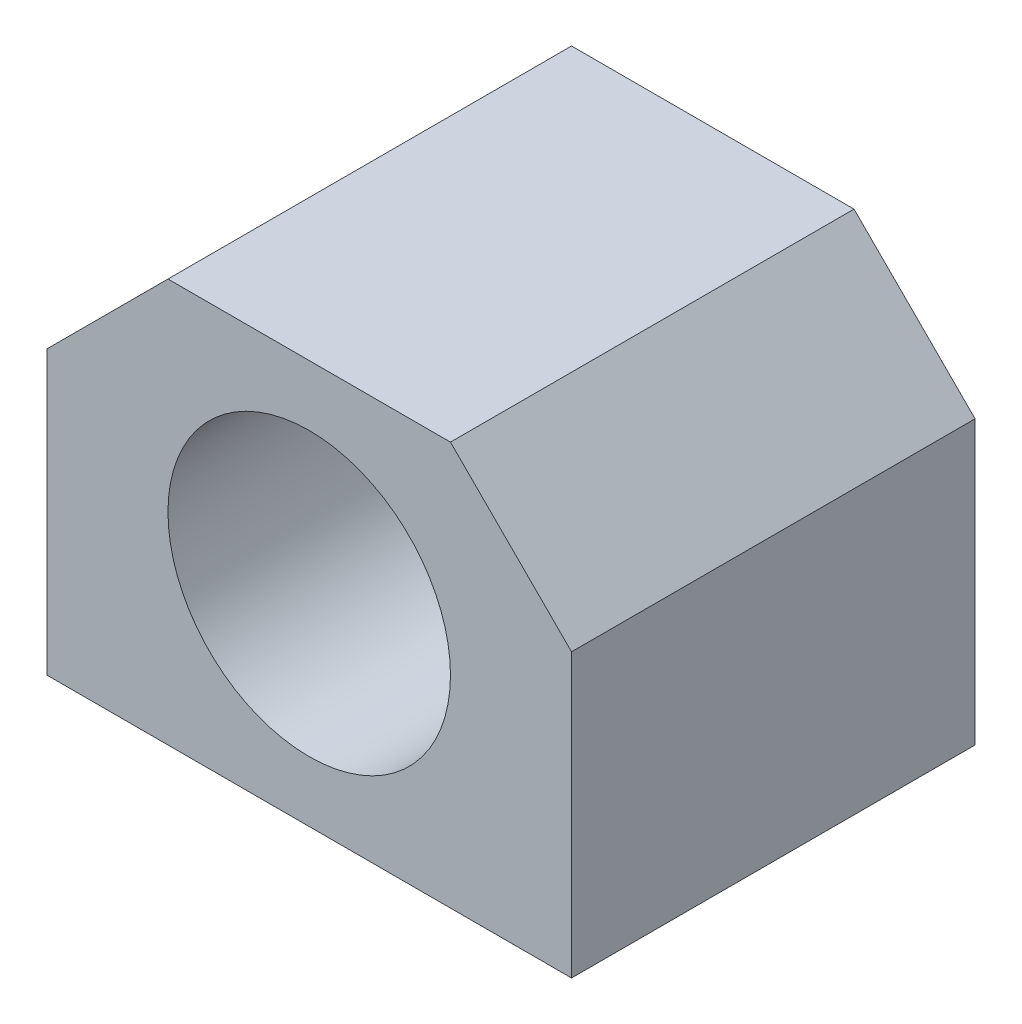
from build123d import *

# Parameters (mm, degrees)
SKETCH1_R           = 14
BOSS_EXTRUDE1_DEPTH = 40


with BuildPart() as part:
    # Sketch1 → Boss-Extrude1 (new body)
    with BuildSketch(Plane.XY):
        Polygon((-14, 20), (14, 20), (26, 8), (26, -20), (-26, -20), (-26, 8), align=None)
        Circle(SKETCH1_R, mode=Mode.SUBTRACT)
    extrude(amount=BOSS_EXTRUDE1_DEPTH)


solid = part.part
